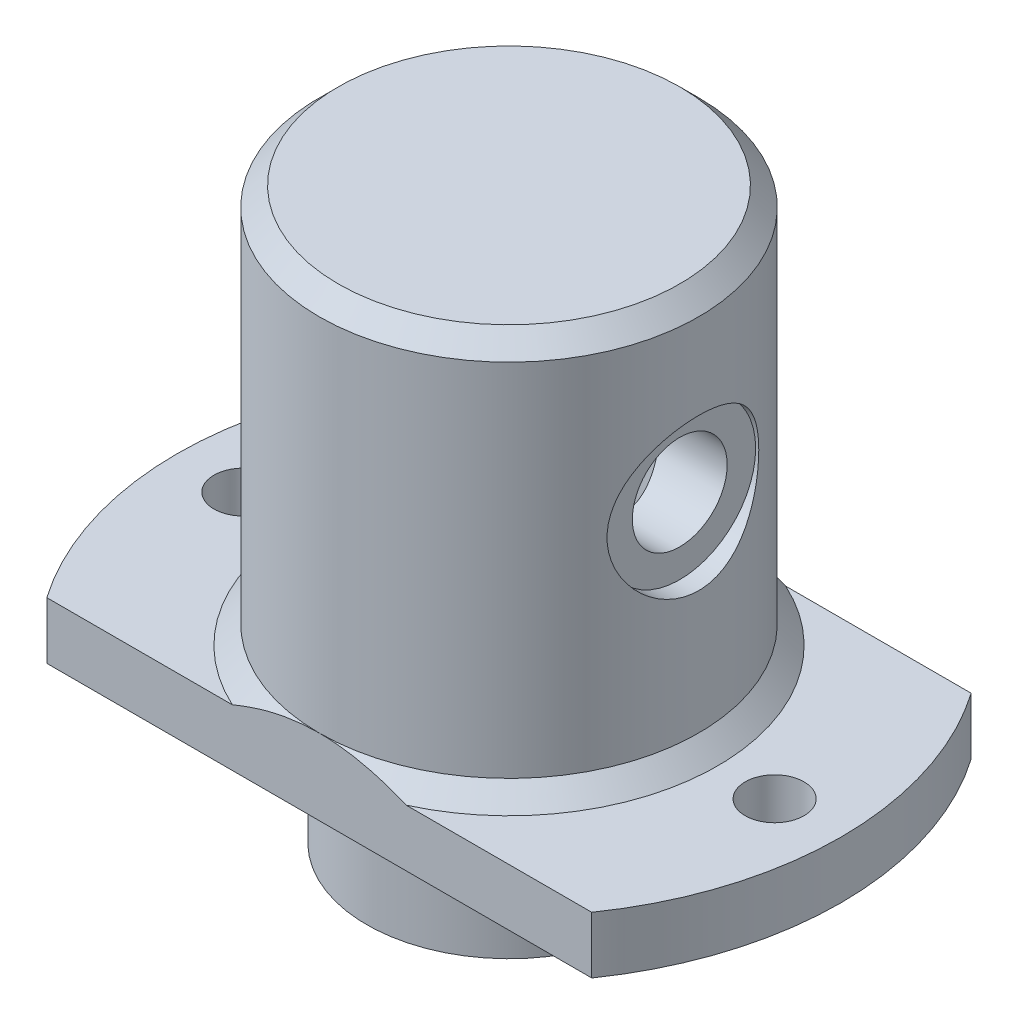
from build123d import *

# Parameters (mm, degrees)
SKETCH1_R           = 10
BOSS_EXTRUDE1_DEPTH = 21
SKETCH2_R           = 1.55
BOSS_EXTRUDE2_DEPTH = 3
SKETCH3_R           = 7.5
BOSS_EXTRUDE3_DEPTH = 6
SKETCH4_R           = 6
CUT_EXTRUDE1_DEPTH  = 25
SKETCH6_R           = 4
CUT_EXTRUDE2_DEPTH  = 1
SKETCH7_R           = 2.5
CUT_EXTRUDE3_DEPTH  = 6
CHAMFER1_SIZE       = 1


with BuildPart() as part:
    # Sketch1 → Boss-Extrude1 (new body)
    with BuildSketch(Plane(origin=(0, 0, 0), x_dir=(1, 0, 0), z_dir=(0, 1, 0))):
        with Locations(Location((0, 0, 0), (0, 0, 90))):
            Circle(SKETCH1_R)
    extrude(amount=BOSS_EXTRUDE1_DEPTH)

    # Sketch2 → Boss-Extrude2 (add)
    with BuildSketch(Plane.XZ):
        with BuildLine():
            Line((-14.361406616, -10), (14.361406616, -10))
            ThreePointArc((14.361406616, -10), (17.5, 0), (14.361406616, 10))
            Line((14.361406616, 10), (-14.361406616, 10))
            ThreePointArc((-14.361406616, 10), (-17.5, 0), (-14.361406616, -10))
        make_face()
        with Locations(Location((-14, 0, 0), (0, 0, 270))):
            Circle(SKETCH2_R, mode=Mode.SUBTRACT)
        with Locations(Location((14, 0, 0), (0, 0, 270))):
            Circle(SKETCH2_R, mode=Mode.SUBTRACT)
    extrude(amount=BOSS_EXTRUDE2_DEPTH)

    # Sketch3 → Boss-Extrude3 (add)
    with BuildSketch(Plane.XZ.offset(3)):
        with Locations(Location((0, 0, 0), (0, 0, 270))):
            Circle(SKETCH3_R)
    extrude(amount=BOSS_EXTRUDE3_DEPTH)

    # Sketch4 → Cut-Extrude1 (cut)
    with BuildSketch(Plane.XZ.offset(9)):
        with Locations(Location((0, 0, 0), (0, 0, 270))):
            Circle(SKETCH4_R)
    extrude(amount=-CUT_EXTRUDE1_DEPTH, mode=Mode.SUBTRACT)

    # Sketch6 → Cut-Extrude2 (cut)
    with BuildSketch(Plane(origin=(10, 0, 0), x_dir=(0, 0, -1), z_dir=(1, 0, 0))):
        with Locations((0, 11.5)):
            Circle(SKETCH6_R)
    extrude(amount=-CUT_EXTRUDE2_DEPTH, mode=Mode.SUBTRACT)

    # Sketch7 → Cut-Extrude3 (cut)
    with BuildSketch(Plane(origin=(9, 0, 0), x_dir=(0, 0, -1), z_dir=(1, 0, 0))):
        with Locations((0, 11.5)):
            Circle(SKETCH7_R)
    extrude(amount=-CUT_EXTRUDE3_DEPTH, mode=Mode.SUBTRACT)

    # Chamfer1
    # the kernel refuses this chamfer: 1 mm, written as the material it adds along each edge
    with BuildSketch(Plane(origin=(0, 0, 0), x_dir=(-2.2377941338409155e-09, 0, 1.0), z_dir=(-1.0, 0, -2.2377941338409155e-09))) as chamfer1_piece_1_section:
        Polygon((10, CHAMFER1_SIZE), (10 + CHAMFER1_SIZE, 0), (10, 0), align=None)
    chamfer1_piece_1 = revolve(axis=Axis((0, 0, 0), (0, 1, 0)), revolution_arc=180.000000128, mode=Mode.PRIVATE)
    chamfer1_piece_1 = split(chamfer1_piece_1, bisect_by=Plane(origin=(10.483044341, 0.483044342, -10), z_dir=(0, 0, 1)), keep=Keep.TOP, mode=Mode.PRIVATE)
    chamfer1_piece_1 = split(chamfer1_piece_1, bisect_by=Plane(origin=(10.483044341, 0.483044342, 10), z_dir=(0, 0, -1)), keep=Keep.TOP, mode=Mode.PRIVATE)
    add(chamfer1_piece_1)
    with BuildSketch(Plane(origin=(0, 0, 0), x_dir=(0, 0, -1), z_dir=(1, 0, 0))) as chamfer1_piece_2_section:
        Polygon((10, CHAMFER1_SIZE), (10 + CHAMFER1_SIZE, 0), (10, 0), align=None)
    chamfer1_piece_2 = revolve(axis=Axis((0, 0, 0), (0, 1, 0)), revolution_arc=179.999999872, mode=Mode.PRIVATE)
    chamfer1_piece_2 = split(chamfer1_piece_2, bisect_by=Plane(origin=(-10.483044341, 0.483044341, -10), z_dir=(0, 0, 1)), keep=Keep.TOP, mode=Mode.PRIVATE)
    chamfer1_piece_2 = split(chamfer1_piece_2, bisect_by=Plane(origin=(-10.483044341, 0.483044341, 10), z_dir=(0, 0, -1)), keep=Keep.TOP, mode=Mode.PRIVATE)
    add(chamfer1_piece_2)
    # the kernel refuses this chamfer: 1 mm, written as the material it takes off along each edge
    with BuildSketch(Plane(origin=(0, 21, 0), x_dir=(0, 0, -1), z_dir=(1, 0, 0))) as chamfer1_2_piece_1:
        Polygon((10, -CHAMFER1_SIZE), (10 - CHAMFER1_SIZE, 0), (10, 0), align=None)
    revolve(axis=Axis((0, 21, 0), (0, 1, 0)), mode=Mode.SUBTRACT)


solid = part.part
